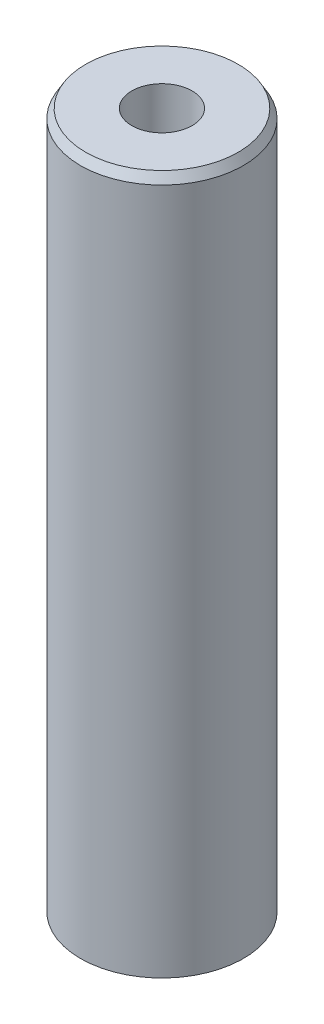
from build123d import *
from OCP.BRepFilletAPI import BRepFilletAPI_MakeChamfer

# Parameters (mm, degrees)
SKETCH1_R           = 27.5
BOSS_EXTRUDE1_DEPTH = 236.650991443
SKETCH2_R           = 10.183565819
CUT_EXTRUDE1_DEPTH  = 240.825335924
CHAMFER1_SIZE       = 3.022487208
CHAMFER1_SIZE2      = 1.745033803


with BuildPart() as part:
    # Sketch1 → Boss-Extrude1 (new body)
    with BuildSketch(Plane(origin=(0, 0, 0), x_dir=(1, 0, 0), z_dir=(0, 1, 0))):
        Circle(SKETCH1_R)
    extrude(amount=BOSS_EXTRUDE1_DEPTH)

    # Sketch2 → Cut-Extrude1 (cut, through all)
    with BuildSketch(Plane(origin=(0, 0, 0), x_dir=(1, 0, 0), z_dir=(0, 1, 0))):
        Circle(SKETCH2_R)
    extrude(amount=CUT_EXTRUDE1_DEPTH, mode=Mode.SUBTRACT)

    # Chamfer1: one chamfer whose edges measure the first distance from different faces: ONE call of the kernel's chamfer builder (chamfer() names one face for all edges)
    chamfer1_edges_1 = [part.edges().sort_by_distance(p)[0] for p in [
        (-27.5, 236.650991443, 0),
    ]]
    chamfer1_side_1 = [part.faces().sort_by_distance(p)[0] for p in [
        (-27.5, 118.325495722, 0),
    ]]
    chamfer1_edges_2 = [part.edges().sort_by_distance(p)[0] for p in [
        (-27.5, 0, 0),
    ]]
    chamfer1_side_2 = [part.faces().sort_by_distance(p)[0] for p in [
        (-26.722182541, 0, 0),
    ]]
    chamfer1 = BRepFilletAPI_MakeChamfer(part.part.solid().wrapped)
    for e in chamfer1_edges_1:
        chamfer1.Add(CHAMFER1_SIZE, CHAMFER1_SIZE2, e.wrapped, chamfer1_side_1[0].wrapped)  # the first distance lies on this face
    for e in chamfer1_edges_2:
        chamfer1.Add(CHAMFER1_SIZE, CHAMFER1_SIZE2, e.wrapped, chamfer1_side_2[0].wrapped)  # the first distance lies on this face
    add(Compound.cast(chamfer1.Shape()), mode=Mode.REPLACE)


solid = part.part
